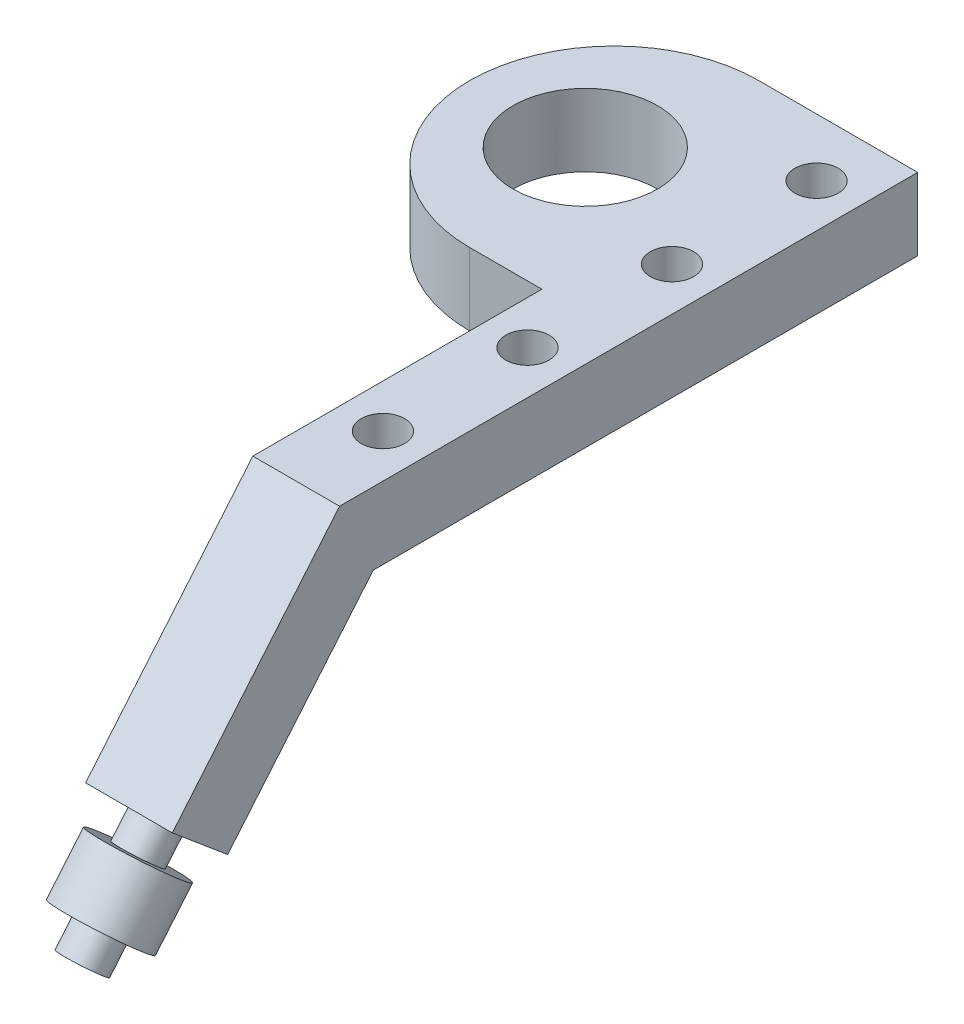
from build123d import *

# Parameters (mm, degrees)
SKETCH1_W                 = 6
SKETCH1_H                 = 40
BOSS_EXTRUDE1_DEPTH       = 5
SKETCH3_R                 = 1.5
CUT_EXTRUDE1_DEPTH        = 41.755367745
LPATTERN1_COUNT           = 4
LPATTERN1_PITCH           = 10
BOSS_EXTRUDE3_DEPTH       = 6
SKETCH12_R                = 1.5
BOSS_EXTRUDE7_DEPTH       = 8
SKETCH10_W                = 20
SKETCH10_H                = 5
BOSS_EXTRUDE6_DEPTH       = 15
CUT_EXTRUDE2_REACH        = 50.278
SKETCH11_R                = 5
FILLET1_R                 = 10
BOSS_EXTRUDE8_START       = -20.169777786
BOSS_EXTRUDE8_OUTLINE_R   = 3
BOSS_EXTRUDE8_OUTLINE_R_2 = 1.5
BOSS_EXTRUDE8_DEPTH       = 4


# Read off the part's stored shape, not the designer's step: Boss-Extrude8
with BuildPart() as part:
    # Sketch1 → Boss-Extrude1 (new body)
    with BuildSketch(Plane(origin=(0, 0, 0), x_dir=(1, 0, 0), z_dir=(0, 1, 0))):
        with Locations((3, 20)):
            Rectangle(SKETCH1_W, SKETCH1_H)
    extrude(amount=BOSS_EXTRUDE1_DEPTH)

    # Sketch3 → Cut-Extrude1 (cut, through all)
    with BuildSketch(Plane(origin=(0, 0, 0), x_dir=(1, 0, 0), z_dir=(0, 1, 0))):
        with Locations(Location((3, 6, 0), (0, 0, 270))):
            Circle(SKETCH3_R)
    cut_extrude1 = extrude(amount=CUT_EXTRUDE1_DEPTH, mode=Mode.SUBTRACT)

    # LPattern1: Cut-Extrude1 ×4
    with Locations(*[(0, 0, -i * LPATTERN1_PITCH) for i in range(1, LPATTERN1_COUNT)]):
        add(cut_extrude1, mode=Mode.SUBTRACT)

    # Sketch4 → Boss-Extrude3 (add)
    with BuildSketch(Plane(origin=(0, 0, 0), x_dir=(0, 0, -1), z_dir=(1, 0, 0))):
        Polygon((-11.570176974, -8.788799976), (-7.739954759, -12.002738025), (3.830222216, 1.786061952), (0, 5), align=None)
    extrude(amount=BOSS_EXTRUDE3_DEPTH)

    # Sketch12 → Boss-Extrude7 (add)
    with BuildSketch(Plane(origin=(0, -10.854679532, 9.108157592), x_dir=(1, 0, 0), z_dir=(0, -0.7660444431189747, 0.6427876096865434))):
        with Locations(Location((3, 0.713938048, 0), (0, 0, 90))):
            Circle(SKETCH12_R)
    extrude(amount=BOSS_EXTRUDE7_DEPTH)

    # Sketch10 → Boss-Extrude6 (add)
    with BuildSketch(Plane.ZY):
        with Locations((-30, 2.5)):
            Rectangle(SKETCH10_W, SKETCH10_H)
    extrude(amount=BOSS_EXTRUDE6_DEPTH)

    # Sketch11 → Cut-Extrude2 (cut, up to next)
    with BuildSketch(Plane(origin=(0, 5, 0), x_dir=(1, 0, 0), z_dir=(0, 1, 0)), mode=Mode.PRIVATE) as cut_extrude2_sk1:
        with Locations(Location((-7, 30, 0), (0, 0, 270))):
            Circle(SKETCH11_R)
    cut_extrude2_tool1 = extrude(cut_extrude2_sk1.sketch, amount=-CUT_EXTRUDE2_REACH, mode=Mode.PRIVATE) & part.part
    add(cut_extrude2_tool1.solids().sort_by_distance((-7, 5, -30))[0], mode=Mode.SUBTRACT)

    # Fillet1
    fillet1_edges = [part.edges().sort_by_distance(p)[0] for p in [
        (-15, 2.5, -40),
        (-15, 2.5, -20),
    ]]
    fillet(fillet1_edges, radius=FILLET1_R - 0.0001)  # a hair under: the kernel refuses the full size

    # Boss-Extrude8 outline → Boss-Extrude8 (add)
    with BuildSketch(Plane(origin=(0, 0, 0), x_dir=(1, 0, 0), z_dir=(0, 0.766044443118975, -0.642787609686543)).offset(BOSS_EXTRUDE8_START)):
        with Locations((3, -0.713938048)):
            Circle(BOSS_EXTRUDE8_OUTLINE_R)
        with Locations((3, -0.713938048)):
            Circle(BOSS_EXTRUDE8_OUTLINE_R_2, mode=Mode.SUBTRACT)
    extrude(amount=BOSS_EXTRUDE8_DEPTH)


solid = part.part
